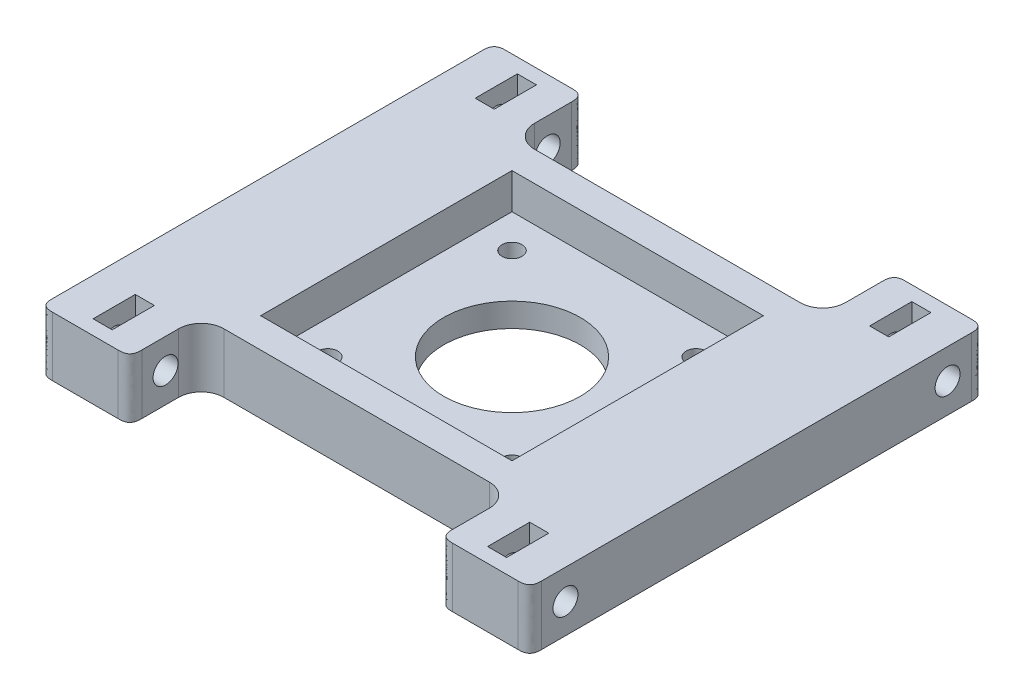
from build123d import *

# Parameters (mm, degrees)
SKETCH1_W               = 42.3
SKETCH1_H               = 42.3
SKETCH1_R               = 1.7
SKETCH1_R_2             = 11.5
BOSS_EXTRUDE1_DEPTH     = 4
SKETCH1_4_W             = 52.3
SKETCH1_4_H             = 52.3
SKETCH1_4_W_2           = 42.3
SKETCH1_4_H_2           = 42.3
BOSS_EXTRUDE2_DEPTH     = 10
BOSS_EXTRUDE3_START     = 26.15
SKETCH3_W               = 76.3
SKETCH3_H               = 10
BOSS_EXTRUDE3_DEPTH     = 15
BOSS_EXTRUDE6_START     = -26.15
SKETCH3_3_W             = 76.3
SKETCH3_3_H             = 10
BOSS_EXTRUDE6_DEPTH     = 15
FILLET1_R               = 3.8
CUT_EXTRUDE1_DEPTH      = 57.997763114
CUT_EXTRUDE1_DEPTH_BACK = 57.997763114
SKETCH4_R               = 2.1
CUT_EXTRUDE2_START      = 10
SKETCH6_W               = 3.211622658
SKETCH6_H               = 7.1
CUT_EXTRUDE2_DEPTH      = 9.12
FILLET2_SIZE            = 2


with BuildPart() as part:
    # Sketch1 → Boss-Extrude1 (new body)
    with BuildSketch(Plane(origin=(0, 0, 0), x_dir=(1, 0, 0), z_dir=(0, 1, 0))):
        Rectangle(SKETCH1_W, SKETCH1_H)
        with Locations(Location((-15.5, 15.5, 0), (0, 0, 270))):
            Circle(SKETCH1_R, mode=Mode.SUBTRACT)
        with Locations(Location((15.5, 15.5, 0), (0, 0, 270))):
            Circle(SKETCH1_R, mode=Mode.SUBTRACT)
        with Locations(Location((15.5, -15.5, 0), (0, 0, 270))):
            Circle(SKETCH1_R, mode=Mode.SUBTRACT)
        with Locations(Location((-15.5, -15.5, 0), (0, 0, 270))):
            Circle(SKETCH1_R, mode=Mode.SUBTRACT)
        with Locations(Location((0, 0, 0), (0, 0, 270))):
            Circle(SKETCH1_R_2, mode=Mode.SUBTRACT)
    extrude(amount=BOSS_EXTRUDE1_DEPTH)

    # Sketch1<4> → Boss-Extrude2 (add)
    with BuildSketch(Plane(origin=(0, 0, 0), x_dir=(1, 0, 0), z_dir=(0, 1, 0))):
        Rectangle(SKETCH1_4_W, SKETCH1_4_H)
        Rectangle(SKETCH1_4_W_2, SKETCH1_4_H_2, mode=Mode.SUBTRACT)
    extrude(amount=BOSS_EXTRUDE2_DEPTH)

    # Sketch3 → Boss-Extrude3 (add)
    with BuildSketch(Plane(origin=(0, 0, 0), x_dir=(0, 0, -1), z_dir=(1, 0, 0)).offset(BOSS_EXTRUDE3_START)):
        with Locations((0, 5)):
            Rectangle(SKETCH3_W, SKETCH3_H)
    extrude(amount=BOSS_EXTRUDE3_DEPTH)

    # Sketch3<3> → Boss-Extrude6 (add)
    with BuildSketch(Plane(origin=(0, 0, 0), x_dir=(0, 0, -1), z_dir=(1, 0, 0)).offset(BOSS_EXTRUDE6_START)):
        with Locations((0, 5)):
            Rectangle(SKETCH3_3_W, SKETCH3_3_H)
    extrude(amount=-BOSS_EXTRUDE6_DEPTH)

    # Fillet1
    fillet1_edges = [part.edges().sort_by_distance(p)[0] for p in [
        (-26.15, 5, 26.15),
        (26.15, 5, 26.15),
        (26.15, 5, -26.15),
        (-26.15, 5, -26.15),
    ]]
    fillet(fillet1_edges, radius=FILLET1_R)

    # Sketch4 → Cut-Extrude1 (cut, two sides: drawn at the far end of the back side and taken through both)
    with BuildSketch(Plane(origin=(0, 0, 0), x_dir=(0, 0, -1), z_dir=(1, 0, 0)).offset(-CUT_EXTRUDE1_DEPTH_BACK)):
        with Locations((-32.15, 5)):
            Circle(SKETCH4_R)
        with Locations((32.15, 5)):
            Circle(SKETCH4_R)
    extrude(amount=CUT_EXTRUDE1_DEPTH + CUT_EXTRUDE1_DEPTH_BACK, mode=Mode.SUBTRACT)

    # Sketch6 → Cut-Extrude2 (cut)
    with BuildSketch(Plane(origin=(0, 0, 0), x_dir=(1, 0, 0), z_dir=(0, 1, 0)).offset(CUT_EXTRUDE2_START)):
        with Locations((-33.19, 32.15)):
            Rectangle(SKETCH6_W, SKETCH6_H)
        with Locations((-33.19, -32.15)):
            Rectangle(SKETCH6_W, SKETCH6_H)
        with Locations((33.19, -32.15)):
            Rectangle(SKETCH6_W, SKETCH6_H)
        with Locations((33.19, 32.15)):
            Rectangle(SKETCH6_W, SKETCH6_H)
    extrude(amount=-CUT_EXTRUDE2_DEPTH, mode=Mode.SUBTRACT)

    # Fillet2
    # a fillet whose section is not a circle: 2 mm, written as the material it takes off along each edge
    with BuildSketch(Plane(origin=(-26.15, 15, -38.15), x_dir=(0, 0, 1), z_dir=(0, -1, 0)), Plane(origin=(41.15, -5, 38.15), x_dir=(0, 0, -1), z_dir=(0, 1, 0)), Plane(origin=(26.15, -5, 38.15), x_dir=(1, 0, 0), z_dir=(0, 1, 0)), Plane(origin=(-41.15, 15, -38.15), x_dir=(1, 0, 0), z_dir=(0, -1, 0))) as fillet2_piece_1:
        with BuildLine():
            add(Edge.make_bspline([(FILLET2_SIZE, 0), (FILLET2_SIZE * 0.831801948466, 0), (FILLET2_SIZE * 0.663603896932, 0), (FILLET2_SIZE * 0.292893218813, FILLET2_SIZE * 0.0716919198361), (FILLET2_SIZE * 0.0716919198361, FILLET2_SIZE * 0.292893218813), (0, FILLET2_SIZE * 0.663603896932), (0, FILLET2_SIZE * 0.831801948466), (0, FILLET2_SIZE)], knots=[0, 0, 0, 0, 0, 0, 0.5, 0.5, 1, 1, 1, 1, 1, 1], degree=5))
            Line((0, FILLET2_SIZE), (0, 0))
            Line((0, 0), (FILLET2_SIZE, 0))
        make_face()
    extrude(amount=20, mode=Mode.SUBTRACT)
    with BuildSketch(Plane(origin=(26.15, 15, -38.15), x_dir=(0, 0, 1), z_dir=(0, -1, 0)), Plane(origin=(41.15, 15, -38.15), x_dir=(-1, 0, 0), z_dir=(0, -1, 0)), Plane(origin=(-26.15, -5, 38.15), x_dir=(-1, 0, 0), z_dir=(0, 1, 0)), Plane(origin=(-41.15, -5, 38.15), x_dir=(0, 0, -1), z_dir=(0, 1, 0))) as fillet2_piece_2:
        with BuildLine():
            add(Edge.make_bspline([(FILLET2_SIZE, 0), (FILLET2_SIZE * 0.831801948466, 0), (FILLET2_SIZE * 0.663603896932, 0), (FILLET2_SIZE * 0.292893218813, -FILLET2_SIZE * 0.0716919198361), (FILLET2_SIZE * 0.0716919198361, -FILLET2_SIZE * 0.292893218813), (0, -FILLET2_SIZE * 0.663603896932), (0, -FILLET2_SIZE * 0.831801948466), (0, -FILLET2_SIZE)], knots=[0, 0, 0, 0, 0, 0, 0.5, 0.5, 1, 1, 1, 1, 1, 1], degree=5))
            Line((0, -FILLET2_SIZE), (0, 0))
            Line((0, 0), (FILLET2_SIZE, 0))
        make_face()
    extrude(amount=20, mode=Mode.SUBTRACT)


solid = part.part
